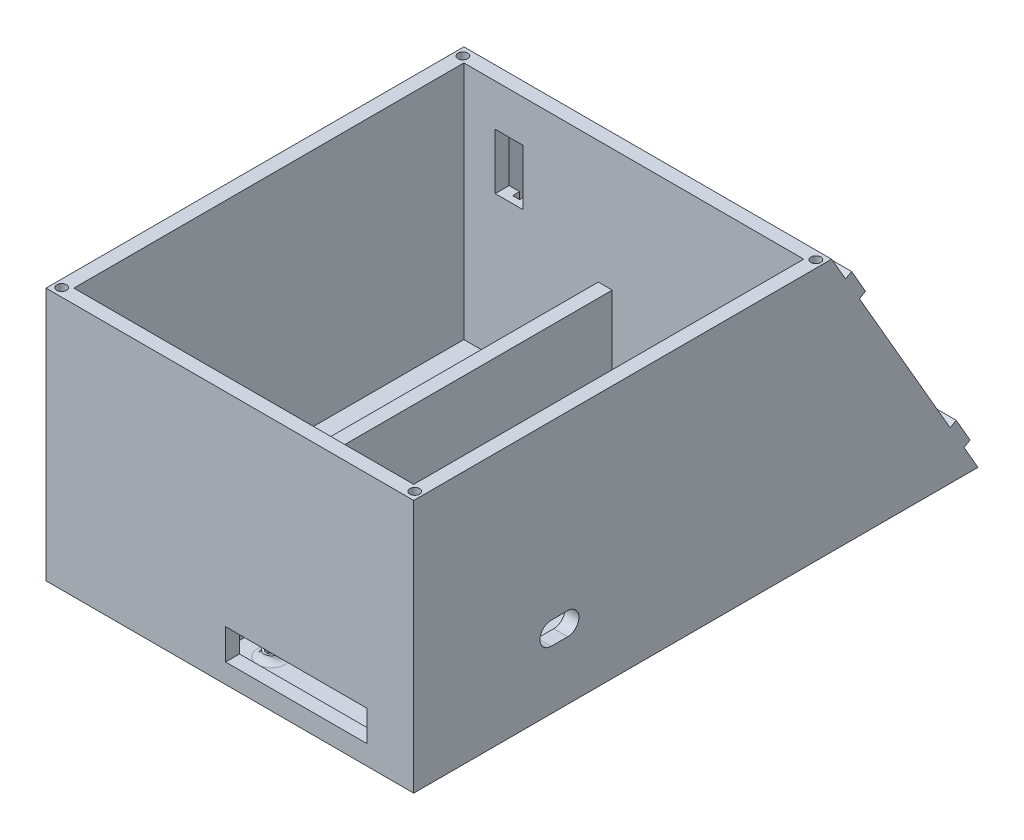
from build123d import *

# Parameters (mm, degrees)
SKETCH1_W           = 132
SKETCH1_H           = 150
BOSS_EXTRUDE1_DEPTH = 91
SKETCH2_W           = 122
SKETCH2_H           = 140
CUT_EXTRUDE1_DEPTH  = 86
SKETCH4_W           = 5
SKETCH4_H           = 140
BOSS_EXTRUDE2_DEPTH = 42
SKETCH7_W           = 5
SKETCH7_H           = 10
CUT_EXTRUDE3_DEPTH  = 10
SKETCH8_R           = 1.75
SKETCH8_R_2         = 1.7
CUT_EXTRUDE4_DEPTH  = 10
SKETCH9_R           = 4
CUT_EXTRUDE6_DEPTH  = 2
SKETCH15_R          = 1.75
CUT_EXTRUDE10_DEPTH = 10
SKETCH20_R          = 2.5
SKETCH20_R_2        = 1.75
BOSS_EXTRUDE3_DEPTH = 2
FILLET1_R           = 2.5
SKETCH21_W          = 50.8
SKETCH21_H          = 11
CUT_EXTRUDE15_DEPTH = 10
CUT_EXTRUDE16_DEPTH = 10
CUT_EXTRUDE17_DEPTH = 2.5
SKETCH28_W          = 5.4
SKETCH28_H          = 2.5
CUT_EXTRUDE19_DEPTH = 5.5
SKETCH29_W          = 10
SKETCH29_H          = 20
CUT_EXTRUDE20_DEPTH = 20.5
BOSS_EXTRUDE6_DEPTH = 5
BOSS_EXTRUDE7_DEPTH = 5
SKETCH32_W          = 13
SKETCH32_H          = 10
BOSS_EXTRUDE8_DEPTH = 2.5
SKETCH33_R          = 1.75
CUT_EXTRUDE21_DEPTH = 4


with BuildPart() as part:
    # Sketch1 → Boss-Extrude1 (new body)
    with BuildSketch(Plane(origin=(0, 0, 0), x_dir=(1, 0, 0), z_dir=(0, 1, 0))):
        Rectangle(SKETCH1_W, SKETCH1_H)
    extrude(amount=BOSS_EXTRUDE1_DEPTH)

    # Sketch2 → Cut-Extrude1 (cut)
    with BuildSketch(Plane(origin=(0, 91, 0), x_dir=(1, 0, 0), z_dir=(0, 1, 0))):
        Rectangle(SKETCH2_W, SKETCH2_H)
    extrude(amount=-CUT_EXTRUDE1_DEPTH, mode=Mode.SUBTRACT)

    # Sketch4 → Boss-Extrude2 (add)
    with BuildSketch(Plane(origin=(0, 5, 0), x_dir=(1, 0, 0), z_dir=(0, 1, 0))):
        with Locations((-10.25, 0)):
            Rectangle(SKETCH4_W, SKETCH4_H)
    extrude(amount=BOSS_EXTRUDE2_DEPTH)

    # Sketch7 → Cut-Extrude3 (cut)
    with BuildSketch(Plane(origin=(-7.75, 0, 0), x_dir=(0, 0, -1), z_dir=(1, 0, 0))):
        with Locations((-50.863290262, 20)):
            Rectangle(SKETCH7_W, SKETCH7_H)
    extrude(amount=-CUT_EXTRUDE3_DEPTH, mode=Mode.SUBTRACT)

    # Sketch8 → Cut-Extrude4 (cut)
    with BuildSketch(Plane(origin=(0, 5, 0), x_dir=(1, 0, 0), z_dir=(0, 1, 0))):
        with Locations(Location((26.625, 0, 0), (0, 0, 270))):
            Circle(SKETCH8_R)
        with Locations(Location((-36.875, 0, 0), (0, 0, 270))):
            Circle(SKETCH8_R_2)
    extrude(amount=-CUT_EXTRUDE4_DEPTH, mode=Mode.SUBTRACT)

    # Sketch9 → Cut-Extrude6 (cut)
    with BuildSketch(Plane(origin=(0, 5, 0), x_dir=(1, 0, 0), z_dir=(0, 1, 0))):
        with Locations(Location((26.625, 0, 0), (0, 0, 270))):
            Circle(SKETCH9_R)
        with Locations(Location((-36.875, 0, 0), (0, 0, 270))):
            Circle(SKETCH9_R)
    extrude(amount=-CUT_EXTRUDE6_DEPTH, mode=Mode.SUBTRACT)

    # Sketch15 → Cut-Extrude10 (cut)
    with BuildSketch(Plane(origin=(0, 91, 0), x_dir=(1, 0, 0), z_dir=(0, 1, 0))):
        with Locations(Location((63.35748842, -71.997145932, 0), (0, 0, 270))):
            Circle(SKETCH15_R)
        with Locations(Location((-63.35748842, -71.997145932, 0), (0, 0, 90))):
            Circle(SKETCH15_R)
        with Locations(Location((-63.35748842, 71.997145932, 0), (0, 0, 270))):
            Circle(SKETCH15_R)
        with Locations(Location((63.35748842, 71.997145932, 0), (0, 0, 90))):
            Circle(SKETCH15_R)
    extrude(amount=-CUT_EXTRUDE10_DEPTH, mode=Mode.SUBTRACT)

    # Sketch20 → Boss-Extrude3 (add)
    # profile 1 of 4: a face of its own
    with BuildSketch(Plane(origin=(0, 5, 0), x_dir=(1, 0, 0), z_dir=(0, 1, 0))):
        with Locations(Location((2.975, -63.125, 0), (0, 0, 270))):
            Circle(SKETCH20_R)
        with Locations(Location((2.975, -63.125, 0), (0, 0, 270))):
            Circle(SKETCH20_R_2, mode=Mode.SUBTRACT)
    # profile 2 of 4: a face of its own
    with BuildSketch(Plane(origin=(0, 5, 0), x_dir=(1, 0, 0), z_dir=(0, 1, 0))):
        with Locations(Location((2.975, 13.125, 0), (0, 0, 270))):
            Circle(SKETCH20_R)
        with Locations(Location((2.975, 13.125, 0), (0, 0, 270))):
            Circle(SKETCH20_R_2, mode=Mode.SUBTRACT)
    # profile 3 of 4: a face of its own
    with BuildSketch(Plane(origin=(0, 5, 0), x_dir=(1, 0, 0), z_dir=(0, 1, 0))):
        with Locations(Location((50.275, 13.125, 0), (0, 0, 270))):
            Circle(SKETCH20_R)
        with Locations(Location((50.275, 13.125, 0), (0, 0, 270))):
            Circle(SKETCH20_R_2, mode=Mode.SUBTRACT)
    # profile 4 of 4: a face of its own
    with BuildSketch(Plane(origin=(0, 5, 0), x_dir=(1, 0, 0), z_dir=(0, 1, 0))):
        with Locations(Location((50.275, -63.125, 0), (0, 0, 270))):
            Circle(SKETCH20_R)
        with Locations(Location((50.275, -63.125, 0), (0, 0, 270))):
            Circle(SKETCH20_R_2, mode=Mode.SUBTRACT)
    extrude(amount=BOSS_EXTRUDE3_DEPTH)

    # Fillet1
    # the kernel refuses this fillet: 2.5 mm, written as the material it adds along each edge
    with BuildSketch(Plane(origin=(2.975, 5, 63.125), x_dir=(0, 0, 1), z_dir=(-1, 0, 0))) as fillet1_piece_1:
        with BuildLine():
            CenterArc((4.949489743, 2.5), FILLET1_R, 191.536959033, 78.463040967)
            Line((2.5, 2), (2.451010205, 1.99))
            ThreePointArc((2.451010205, 1.99), (2.45, 1), (2.45, 0))
            Line((2.45, 0), (2.5, -0.05))
            Line((2.5, -0.05), (4.949489743, -0.05))
            Line((4.949489743, -0.05), (4.949489743, 0))
        make_face()
    revolve(axis=Axis((2.975, 5, 63.125), (0, 1, 0)))
    with BuildSketch(Plane(origin=(2.975, 5, -13.125), x_dir=(0, 0, 1), z_dir=(-1, 0, 0))) as fillet1_piece_2:
        with BuildLine():
            CenterArc((4.949489743, 2.5), FILLET1_R, 191.536959033, 78.463040967)
            Line((2.5, 2), (2.451010205, 1.99))
            ThreePointArc((2.451010205, 1.99), (2.45, 1), (2.45, 0))
            Line((2.45, 0), (2.5, -0.05))
            Line((2.5, -0.05), (4.949489743, -0.05))
            Line((4.949489743, -0.05), (4.949489743, 0))
        make_face()
    revolve(axis=Axis((2.975, 5, -13.125), (0, 1, 0)))
    with BuildSketch(Plane(origin=(50.275, 5, -13.125), x_dir=(0, 0, 1), z_dir=(-1, 0, 0))) as fillet1_piece_3:
        with BuildLine():
            CenterArc((4.949489743, 2.5), FILLET1_R, 191.536959033, 78.463040967)
            Line((2.5, 2), (2.451010205, 1.99))
            ThreePointArc((2.451010205, 1.99), (2.45, 1), (2.45, 0))
            Line((2.45, 0), (2.5, -0.05))
            Line((2.5, -0.05), (4.949489743, -0.05))
            Line((4.949489743, -0.05), (4.949489743, 0))
        make_face()
    revolve(axis=Axis((50.275, 5, -13.125), (0, 1, 0)))
    with BuildSketch(Plane(origin=(50.275, 5, 63.125), x_dir=(0, 0, 1), z_dir=(-1, 0, 0))) as fillet1_piece_4:
        with BuildLine():
            CenterArc((4.949489743, 2.5), FILLET1_R, 191.536959033, 78.463040967)
            Line((2.5, 2), (2.451010205, 1.99))
            ThreePointArc((2.451010205, 1.99), (2.45, 1), (2.45, 0))
            Line((2.45, 0), (2.5, -0.05))
            Line((2.5, -0.05), (4.949489743, -0.05))
            Line((4.949489743, -0.05), (4.949489743, 0))
        make_face()
    revolve(axis=Axis((50.275, 5, 63.125), (0, 1, 0)))

    # Sketch21 → Cut-Extrude15 (cut)
    with BuildSketch(Plane(origin=(0, 0, 70), x_dir=(-1, 0, 0), z_dir=(0, 0, -1))):
        with Locations((-23.87, 12.5)):
            Rectangle(SKETCH21_W, SKETCH21_H)
    extrude(amount=-CUT_EXTRUDE15_DEPTH, mode=Mode.SUBTRACT)

    # Sketch22 → Cut-Extrude16 (cut)
    with BuildSketch(Plane.ZY.offset(-61)):
        with BuildLine():
            Line((19.76, 29.1), (25.66, 29.1))
            ThreePointArc((25.66, 29.1), (29.71, 25.05), (25.66, 21))
            Line((25.66, 21), (19.76, 21))
            ThreePointArc((19.76, 21), (15.71, 25.05), (19.76, 29.1))
        make_face()
    extrude(amount=-CUT_EXTRUDE16_DEPTH, mode=Mode.SUBTRACT)

    # Sketch26 → Cut-Extrude17 (cut)
    with BuildSketch(Plane(origin=(0, 0, -75), x_dir=(-1, 0, 0), z_dir=(0, 0, -1))):
        Polygon((43.5, 22.5), (43.5, 56), (46, 56), (46, 20), (43.5, 20), (19.9, 20), (19.9, 22.5), (19.9, 35), (12.05, 35), (12.05, 76), (19.9, 76), (19.9, 83), (-21.95, 83), (-21.95, 75.5), (-15.95, 75.5), (-15.95, 13.5), (-21.95, 13.5), (-21.95, 6), (-24.45, 6), (-53.45, 6), (-53.45, 8.5), (-24.45, 8.5), (-24.45, 13.5), (-30.45, 13.5), (-30.45, 75.5), (-24.45, 75.5), (-24.45, 83), (-24.45, 85.5), (22.4, 85.5), (22.4, 83), (22.4, 76), (30.25, 76), (30.25, 35), (22.4, 35), (22.4, 22.5), align=None)
    extrude(amount=-CUT_EXTRUDE17_DEPTH, mode=Mode.SUBTRACT)

    # Sketch28 → Cut-Extrude19 (cut)
    with BuildSketch(Plane(origin=(0, 0, -75), x_dir=(-1, 0, 0), z_dir=(0, 0, -1))):
        with Locations((-56.15, 7.25)):
            Rectangle(SKETCH28_W, SKETCH28_H)
    extrude(amount=-CUT_EXTRUDE19_DEPTH, mode=Mode.SUBTRACT)

    # Sketch29 → Cut-Extrude20 (cut)
    with BuildSketch(Plane(origin=(0, 0, -75), x_dir=(-1, 0, 0), z_dir=(0, 0, -1))):
        with Locations((44.75, 66)):
            Rectangle(SKETCH29_W, SKETCH29_H)
    extrude(amount=-CUT_EXTRUDE20_DEPTH, mode=Mode.SUBTRACT)

    # Sketch30 → Boss-Extrude6 (add)
    with BuildSketch(Plane(origin=(66, 0, 0), x_dir=(0, 0, -1), z_dir=(1, 0, 0))):
        Polygon((75, 91), (127.538874496, 0), (75, 0), align=None)
    extrude(amount=-BOSS_EXTRUDE6_DEPTH)

    # Sketch31 → Boss-Extrude7 (add)
    with BuildSketch(Plane.ZY.offset(66)):
        Polygon((-75, 91), (-127.538874496, 0), (-75, 0), align=None)
    extrude(amount=-BOSS_EXTRUDE7_DEPTH)

    # Sketch32 → Boss-Extrude8 (add)
    with BuildSketch(Plane(origin=(0, 55.225952642, -95.654155872), x_dir=(-1, 0, 0), z_dir=(0, 0.49999999999999484, -0.8660254037844418))):
        with Locations((-59.5, 26.308311744)):
            Rectangle(SKETCH32_W, SKETCH32_H)
        with Locations((-59.5, -48.769437248)):
            Rectangle(SKETCH32_W, SKETCH32_H)
        with Locations((59.5, 26.308311744)):
            Rectangle(SKETCH32_W, SKETCH32_H)
        with Locations((59.5, -48.769437248)):
            Rectangle(SKETCH32_W, SKETCH32_H)
    extrude(amount=BOSS_EXTRUDE8_DEPTH)

    # Sketch33 → Cut-Extrude21 (cut)
    with BuildSketch(Plane(origin=(0, 56.475952642, -97.819219382), x_dir=(-1, 0, 0), z_dir=(0, 0.49999999999999434, -0.8660254037844419))):
        with Locations(Location((-59.5, 26.308311744, 0), (0, 0, 90))):
            Circle(SKETCH33_R)
        with Locations(Location((-59.5, -48.769437248, 0), (0, 0, 90))):
            Circle(SKETCH33_R)
        with Locations(Location((59.5, 26.308311744, 0), (0, 0, 90))):
            Circle(SKETCH33_R)
        with Locations(Location((59.5, -48.769437248, 0), (0, 0, 90))):
            Circle(SKETCH33_R)
    extrude(amount=-CUT_EXTRUDE21_DEPTH, mode=Mode.SUBTRACT)


solid = part.part
